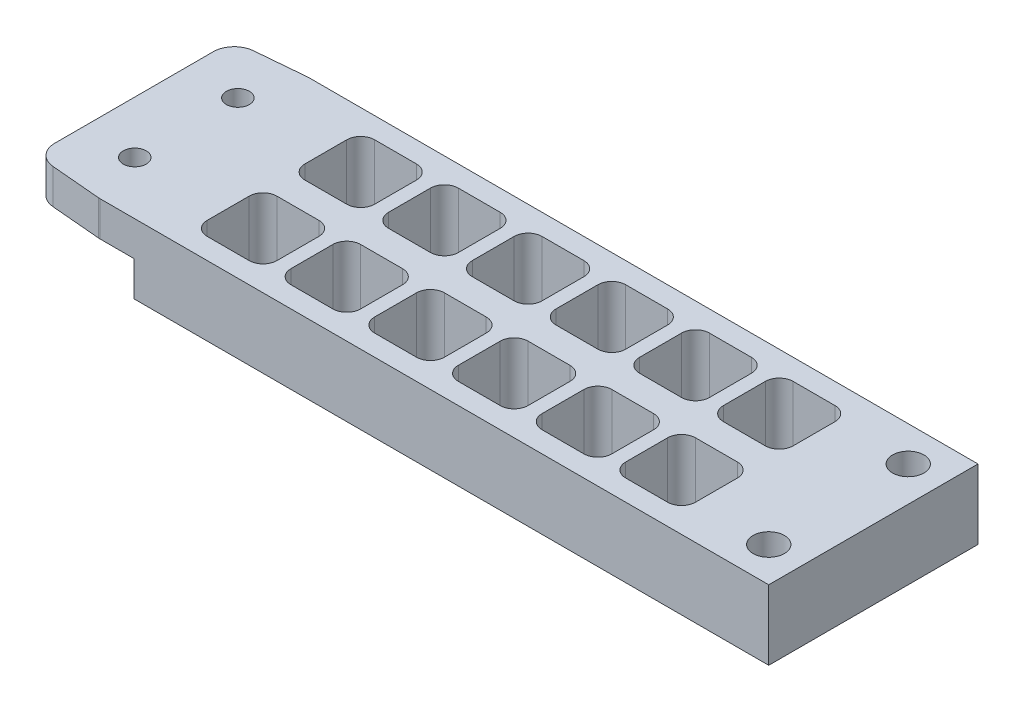
from build123d import *

# Parameters (mm, degrees)
EXTRUDE_1_DEPTH     = 10
SKETCH_4_W          = 15
SKETCH_4_H          = 30
CUT_EXTRUDE_2_DEPTH = 5
FILLET_1_R          = 3
CUT_EXTRUDE_3_DEPTH = 111.616454472
HOLE_WIZARD_M41_D   = 4.5
M4X0_72_D           = 3.3


with BuildPart() as part:
    # Эскиз1 → Бобышка-Вытянуть1 (new body)
    with BuildSketch(Plane(origin=(0, 0, 0), x_dir=(1, 0, 0), z_dir=(0, 1, 0))):
        Polygon((15, 0), (106, 0), (106, 30), (15, 30), (10, 30), (0, 29.125113365), (0, 0.874886635), (10, 0), align=None)
    extrude(amount=EXTRUDE_1_DEPTH)

    # Эскиз4 → Вырез-Вытянуть2 (cut)
    with BuildSketch(Plane.XZ):
        with Locations((7.5, -15)):
            Rectangle(SKETCH_4_W, SKETCH_4_H)
    extrude(amount=-CUT_EXTRUDE_2_DEPTH, mode=Mode.SUBTRACT)

    # Скругление1
    # the kernel refuses this fillet: 3 mm, written as the material it takes off along each edge
    with BuildSketch(Plane(origin=(10, 4.672542928, 0), x_dir=(1, 0, 0), z_dir=(0, 1, 0))) as fillet_1_piece_1:
        with BuildLine():
            CenterArc((FILLET_1_R * 0.0436609429085, FILLET_1_R), FILLET_1_R, 265, 5)
            Line((-FILLET_1_R * 0.0434947998391, FILLET_1_R * 0.00380530190825), (0, 0))
            Line((0, 0), (FILLET_1_R * 0.0436609429085, 0))
        make_face()
    extrude(amount=5.654914144, mode=Mode.SUBTRACT)
    with BuildSketch(Plane(origin=(0, -1.872483805, -0.874886635), x_dir=(0.9961946980917452, 0, 0.08715574274766158), z_dir=(0, 1, 0))) as fillet_1_piece_2:
        with BuildLine():
            CenterArc((FILLET_1_R * 0.916331174017, FILLET_1_R), FILLET_1_R, 185, 85)
            Line((-FILLET_1_R * 0.0798635240743, FILLET_1_R * 0.912844257252), (0, 0))
            Line((0, 0), (FILLET_1_R * 0.916331174017, 0))
        make_face()
    extrude(amount=18.74496761, mode=Mode.SUBTRACT)
    with BuildSketch(Plane(origin=(0, -1.872483805, -29.125113365), x_dir=(0.9961946980917452, 0, -0.08715574274766201), z_dir=(0, 1, 0))) as fillet_1_piece_3:
        with BuildLine():
            CenterArc((FILLET_1_R * 0.916331174017, -FILLET_1_R), FILLET_1_R, 90, 85)
            Line((-FILLET_1_R * 0.0798635240743, -FILLET_1_R * 0.912844257252), (0, 0))
            Line((0, 0), (FILLET_1_R * 0.916331174017, 0))
        make_face()
    extrude(amount=18.74496761, mode=Mode.SUBTRACT)
    with BuildSketch(Plane(origin=(10, 4.672542928, -30), x_dir=(1, 0, 0), z_dir=(0, 1, 0))) as fillet_1_piece_4:
        with BuildLine():
            CenterArc((FILLET_1_R * 0.0436609429085, -FILLET_1_R), FILLET_1_R, 90, 5)
            Line((-FILLET_1_R * 0.0434947998391, -FILLET_1_R * 0.00380530190825), (0, 0))
            Line((0, 0), (FILLET_1_R * 0.0436609429085, 0))
        make_face()
    extrude(amount=5.654914144, mode=Mode.SUBTRACT)

    # Эскиз5 → Вырез-Вытянуть3 (cut, through all)
    with BuildSketch(Plane.XZ):
        with BuildLine():
            Line((22.5, -17), (28.5, -17))
            ThreePointArc((28.5, -17), (29.914213562, -17.585786438), (30.5, -19))
            Line((30.5, -19), (30.5, -25))
            ThreePointArc((30.5, -25), (29.914213562, -26.414213562), (28.5, -27))
            Line((28.5, -27), (22.5, -27))
            ThreePointArc((22.5, -27), (21.085786438, -26.414213562), (20.5, -25))
            Line((20.5, -25), (20.5, -19))
            ThreePointArc((20.5, -19), (21.085786438, -17.585786438), (22.5, -17))
        make_face()
        with BuildLine():
            Line((34.5, -17), (40.5, -17))
            ThreePointArc((40.5, -17), (41.914213562, -17.585786438), (42.5, -19))
            Line((42.5, -19), (42.5, -25))
            ThreePointArc((42.5, -25), (41.914213562, -26.414213562), (40.5, -27))
            Line((40.5, -27), (34.5, -27))
            ThreePointArc((34.5, -27), (33.085786438, -26.414213562), (32.5, -25))
            Line((32.5, -25), (32.5, -19))
            ThreePointArc((32.5, -19), (33.085786438, -17.585786438), (34.5, -17))
        make_face()
        with BuildLine():
            Line((46.5, -17), (52.5, -17))
            ThreePointArc((52.5, -17), (53.914213562, -17.585786438), (54.5, -19))
            Line((54.5, -19), (54.5, -25))
            ThreePointArc((54.5, -25), (53.914213562, -26.414213562), (52.5, -27))
            Line((52.5, -27), (46.5, -27))
            ThreePointArc((46.5, -27), (45.085786438, -26.414213562), (44.5, -25))
            Line((44.5, -25), (44.5, -19))
            ThreePointArc((44.5, -19), (45.085786438, -17.585786438), (46.5, -17))
        make_face()
        with BuildLine():
            Line((58.5, -17), (64.5, -17))
            ThreePointArc((64.5, -17), (65.914213562, -17.585786438), (66.5, -19))
            Line((66.5, -19), (66.5, -25))
            ThreePointArc((66.5, -25), (65.914213562, -26.414213562), (64.5, -27))
            Line((64.5, -27), (58.5, -27))
            ThreePointArc((58.5, -27), (57.085786438, -26.414213562), (56.5, -25))
            Line((56.5, -25), (56.5, -19))
            ThreePointArc((56.5, -19), (57.085786438, -17.585786438), (58.5, -17))
        make_face()
        with BuildLine():
            Line((70.5, -17), (76.5, -17))
            ThreePointArc((76.5, -17), (77.914213562, -17.585786438), (78.5, -19))
            Line((78.5, -19), (78.5, -25))
            ThreePointArc((78.5, -25), (77.914213562, -26.414213562), (76.5, -27))
            Line((76.5, -27), (70.5, -27))
            ThreePointArc((70.5, -27), (69.085786438, -26.414213562), (68.5, -25))
            Line((68.5, -25), (68.5, -19))
            ThreePointArc((68.5, -19), (69.085786438, -17.585786438), (70.5, -17))
        make_face()
        with BuildLine():
            Line((82.5, -17), (88.5, -17))
            ThreePointArc((88.5, -17), (89.914213562, -17.585786438), (90.5, -19))
            Line((90.5, -19), (90.5, -25))
            ThreePointArc((90.5, -25), (89.914213562, -26.414213562), (88.5, -27))
            Line((88.5, -27), (82.5, -27))
            ThreePointArc((82.5, -27), (81.085786438, -26.414213562), (80.5, -25))
            Line((80.5, -25), (80.5, -19))
            ThreePointArc((80.5, -19), (81.085786438, -17.585786438), (82.5, -17))
        make_face()
        with BuildLine():
            Line((90.5, -11), (90.5, -5))
            ThreePointArc((90.5, -5), (89.914213562, -3.585786438), (88.5, -3))
            Line((88.5, -3), (82.5, -3))
            ThreePointArc((82.5, -3), (81.085786438, -3.585786438), (80.5, -5))
            Line((80.5, -5), (80.5, -11))
            ThreePointArc((80.5, -11), (81.085786438, -12.414213562), (82.5, -13))
            Line((82.5, -13), (88.5, -13))
            ThreePointArc((88.5, -13), (89.914213562, -12.414213562), (90.5, -11))
        make_face()
        with BuildLine():
            Line((78.5, -11), (78.5, -5))
            ThreePointArc((78.5, -5), (77.914213562, -3.585786438), (76.5, -3))
            Line((76.5, -3), (70.5, -3))
            ThreePointArc((70.5, -3), (69.085786438, -3.585786438), (68.5, -5))
            Line((68.5, -5), (68.5, -11))
            ThreePointArc((68.5, -11), (69.085786438, -12.414213562), (70.5, -13))
            Line((70.5, -13), (76.5, -13))
            ThreePointArc((76.5, -13), (77.914213562, -12.414213562), (78.5, -11))
        make_face()
        with BuildLine():
            Line((66.5, -11), (66.5, -5))
            ThreePointArc((66.5, -5), (65.914213562, -3.585786438), (64.5, -3))
            Line((64.5, -3), (58.5, -3))
            ThreePointArc((58.5, -3), (57.085786438, -3.585786438), (56.5, -5))
            Line((56.5, -5), (56.5, -11))
            ThreePointArc((56.5, -11), (57.085786438, -12.414213562), (58.5, -13))
            Line((58.5, -13), (64.5, -13))
            ThreePointArc((64.5, -13), (65.914213562, -12.414213562), (66.5, -11))
        make_face()
        with BuildLine():
            Line((54.5, -11), (54.5, -5))
            ThreePointArc((54.5, -5), (53.914213562, -3.585786438), (52.5, -3))
            Line((52.5, -3), (46.5, -3))
            ThreePointArc((46.5, -3), (45.085786438, -3.585786438), (44.5, -5))
            Line((44.5, -5), (44.5, -11))
            ThreePointArc((44.5, -11), (45.085786438, -12.414213562), (46.5, -13))
            Line((46.5, -13), (52.5, -13))
            ThreePointArc((52.5, -13), (53.914213562, -12.414213562), (54.5, -11))
        make_face()
        with BuildLine():
            Line((42.5, -11), (42.5, -5))
            ThreePointArc((42.5, -5), (41.914213562, -3.585786438), (40.5, -3))
            Line((40.5, -3), (34.5, -3))
            ThreePointArc((34.5, -3), (33.085786438, -3.585786438), (32.5, -5))
            Line((32.5, -5), (32.5, -11))
            ThreePointArc((32.5, -11), (33.085786438, -12.414213562), (34.5, -13))
            Line((34.5, -13), (40.5, -13))
            ThreePointArc((40.5, -13), (41.914213562, -12.414213562), (42.5, -11))
        make_face()
        with BuildLine():
            Line((30.5, -11), (30.5, -5))
            ThreePointArc((30.5, -5), (29.914213562, -3.585786438), (28.5, -3))
            Line((28.5, -3), (22.5, -3))
            ThreePointArc((22.5, -3), (21.085786438, -3.585786438), (20.5, -5))
            Line((20.5, -5), (20.5, -11))
            ThreePointArc((20.5, -11), (21.085786438, -12.414213562), (22.5, -13))
            Line((22.5, -13), (28.5, -13))
            ThreePointArc((28.5, -13), (29.914213562, -12.414213562), (30.5, -11))
        make_face()
    extrude(amount=-CUT_EXTRUDE_3_DEPTH, mode=Mode.SUBTRACT)

    # Отверстие с зазором M41 (through all)
    with Locations(Plane(origin=(0, 10, 0), x_dir=(1, 0, 0), z_dir=(0, 1, 0))):
        with Locations((101, 25), (101, 5)):
            Hole(HOLE_WIZARD_M41_D / 2)

    # Отверстие обработанное метчиком M4x0.72 (through all)
    with Locations(Plane(origin=(0, 10, 0), x_dir=(1, 0, 0), z_dir=(0, 1, 0))):
        with Locations((7.5, 22.390639171), (7.5, 7.609360829)):
            Hole(M4X0_72_D / 2)


solid = part.part
